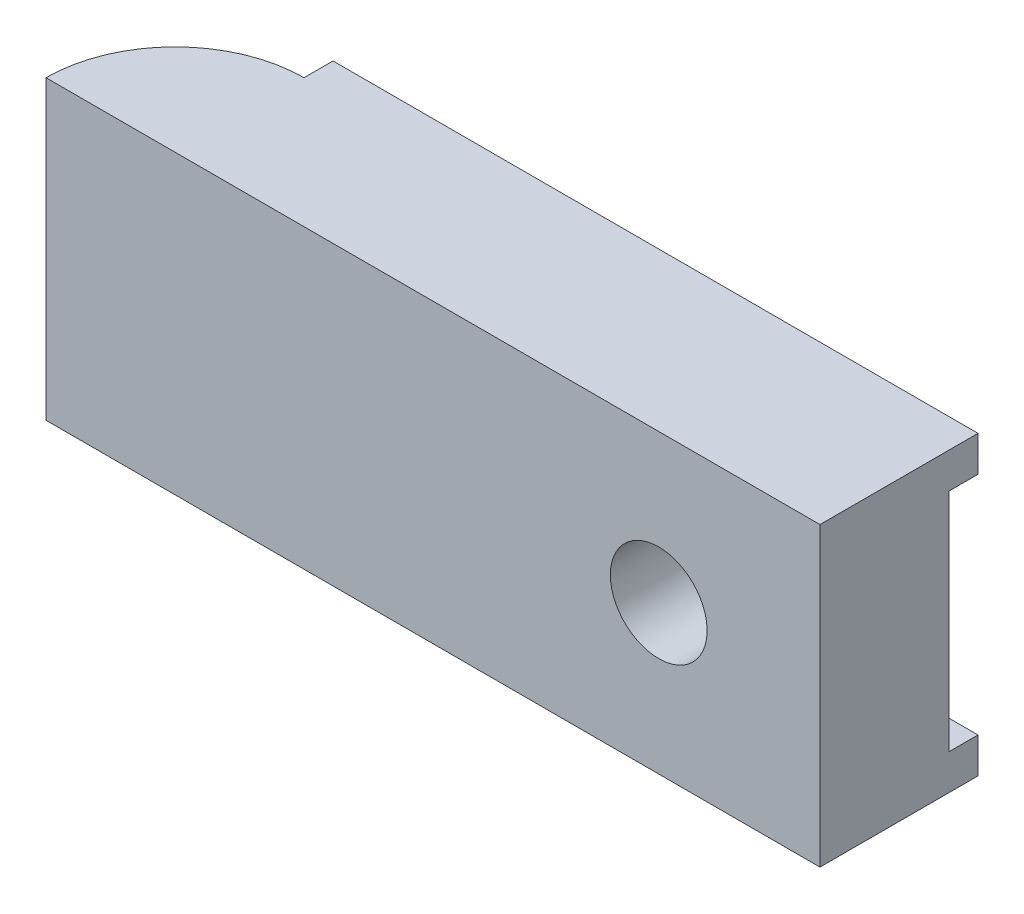
from build123d import *

# Parameters (mm, degrees)
RESSALTO_EXTRUS_O2_DEPTH = 9.2
ESBO_O5_R                = 2.15
CORTE_EXTRUS_O2_DEPTH    = 9.2
CHANFRO2_SIZE            = 0.3
SKETCH1_W                = 12.014068267
SKETCH1_H                = 17.223276929
CUT_EXTRUDE1_DEPTH       = 25
SKETCH3_W                = 4
SKETCH3_H                = 9.2
BOSS_EXTRUDE1_DEPTH      = 5
CUT_EXTRUDE3_DEPTH       = 10
SKETCH5_W                = 42.60578415
SKETCH5_H                = 33.509789151
CUT_EXTRUDE4_DEPTH       = 1.1
SKETCH6_W                = 58.176505701
SKETCH6_H                = 25.888094607
CUT_EXTRUDE5_DEPTH       = 1.1
SKETCH7_W                = 20
SKETCH7_H                = 4.9
BOSS_EXTRUDE2_DEPTH      = 1.1
SKETCH8_W                = 20
SKETCH8_H                = 4.9
BOSS_EXTRUDE3_DEPTH      = 1.1
BOSS_EXTRUDE5_DEPTH      = 9.2


with BuildPart() as part:
    # Esboço4 → Ressalto-extrusão2 (new body)
    with BuildSketch(Plane(origin=(0, 0, 0), x_dir=(1, 0, 0), z_dir=(0, 1, 0))):
        with BuildLine():
            Line((-19.2, 2.35), (-19.2, 1.65))
            ThreePointArc((-19.2, 1.65), (-19.170710678, 1.579289322), (-19.1, 1.55))
            Line((-19.1, 1.55), (-18.1, 1.55))
            ThreePointArc((-18.1, 1.55), (-18.029289322, 1.579289322), (-18, 1.65))
            Line((-18, 1.65), (-18, 2.35))
            ThreePointArc((-18, 2.35), (-17.970710678, 2.420710678), (-17.9, 2.45))
            Line((-17.9, 2.45), (-17.3, 2.45))
            ThreePointArc((-17.3, 2.45), (-17.229289322, 2.420710678), (-17.2, 2.35))
            Line((-17.2, 2.35), (-17.2, 1.65))
            ThreePointArc((-17.2, 1.65), (-17.170710678, 1.579289322), (-17.1, 1.55))
            Line((-17.1, 1.55), (-16.1, 1.55))
            ThreePointArc((-16.1, 1.55), (-16.029289322, 1.579289322), (-16, 1.65))
            Line((-16, 1.65), (-16, 2.35))
            ThreePointArc((-16, 2.35), (-15.970710678, 2.420710678), (-15.9, 2.45))
            Line((-15.9, 2.45), (-15.3, 2.45))
            ThreePointArc((-15.3, 2.45), (-15.229289322, 2.420710678), (-15.2, 2.35))
            Line((-15.2, 2.35), (-15.2, 1.65))
            ThreePointArc((-15.2, 1.65), (-15.170710678, 1.579289322), (-15.1, 1.55))
            Line((-15.1, 1.55), (-14.1, 1.55))
            ThreePointArc((-14.1, 1.55), (-14.029289322, 1.579289322), (-14, 1.65))
            Line((-14, 1.65), (-14, 2.35))
            ThreePointArc((-14, 2.35), (-13.970710678, 2.420710678), (-13.9, 2.45))
            Line((-13.9, 2.45), (-13.3, 2.45))
            ThreePointArc((-13.3, 2.45), (-13.229289322, 2.420710678), (-13.2, 2.35))
            Line((-13.2, 2.35), (-13.2, 1.65))
            ThreePointArc((-13.2, 1.65), (-13.170710678, 1.579289322), (-13.1, 1.55))
            Line((-13.1, 1.55), (-12.1, 1.55))
            ThreePointArc((-12.1, 1.55), (-12.029289322, 1.579289322), (-12, 1.65))
            Line((-12, 1.65), (-12, 2.35))
            ThreePointArc((-12, 2.35), (-11.970710678, 2.420710678), (-11.9, 2.45))
            Line((-11.9, 2.45), (-11.3, 2.45))
            ThreePointArc((-11.3, 2.45), (-11.229289322, 2.420710678), (-11.2, 2.35))
            Line((-11.2, 2.35), (-11.2, 1.65))
            ThreePointArc((-11.2, 1.65), (-11.170710678, 1.579289322), (-11.1, 1.55))
            Line((-11.1, 1.55), (-10.1, 1.55))
            ThreePointArc((-10.1, 1.55), (-10.029289322, 1.579289322), (-10, 1.65))
            Line((-10, 1.65), (-10, 2.35))
            ThreePointArc((-10, 2.35), (-9.970710678, 2.420710678), (-9.9, 2.45))
            Line((-9.9, 2.45), (-9.3, 2.45))
            ThreePointArc((-9.3, 2.45), (-9.229289322, 2.420710678), (-9.2, 2.35))
            Line((-9.2, 2.35), (-9.2, 1.65))
            ThreePointArc((-9.2, 1.65), (-9.170710678, 1.579289322), (-9.1, 1.55))
            Line((-9.1, 1.55), (-8.1, 1.55))
            ThreePointArc((-8.1, 1.55), (-8.029289322, 1.579289322), (-8, 1.65))
            Line((-8, 1.65), (-8, 2.35))
            ThreePointArc((-8, 2.35), (-7.970710678, 2.420710678), (-7.9, 2.45))
            Line((-7.9, 2.45), (-7.3, 2.45))
            ThreePointArc((-7.3, 2.45), (-7.229289322, 2.420710678), (-7.2, 2.35))
            Line((-7.2, 2.35), (-7.2, 1.65))
            ThreePointArc((-7.2, 1.65), (-7.170710678, 1.579289322), (-7.1, 1.55))
            Line((-7.1, 1.55), (7.1, 1.55))
            ThreePointArc((7.1, 1.55), (7.170710678, 1.579289322), (7.2, 1.65))
            Line((7.2, 1.65), (7.2, 2.35))
            ThreePointArc((7.2, 2.35), (7.229289322, 2.420710678), (7.3, 2.45))
            Line((7.3, 2.45), (7.9, 2.45))
            ThreePointArc((7.9, 2.45), (7.970710678, 2.420710678), (8, 2.35))
            Line((8, 2.35), (8, 1.65))
            ThreePointArc((8, 1.65), (8.029289322, 1.579289322), (8.1, 1.55))
            Line((8.1, 1.55), (9.1, 1.55))
            ThreePointArc((9.1, 1.55), (9.170710678, 1.579289322), (9.2, 1.65))
            Line((9.2, 1.65), (9.2, 2.35))
            ThreePointArc((9.2, 2.35), (9.229289322, 2.420710678), (9.3, 2.45))
            Line((9.3, 2.45), (9.9, 2.45))
            ThreePointArc((9.9, 2.45), (9.970710678, 2.420710678), (10, 2.35))
            Line((10, 2.35), (10, 1.65))
            ThreePointArc((10, 1.65), (10.029289322, 1.579289322), (10.1, 1.55))
            Line((10.1, 1.55), (11.1, 1.55))
            ThreePointArc((11.1, 1.55), (11.170710678, 1.579289322), (11.2, 1.65))
            Line((11.2, 1.65), (11.2, 2.35))
            ThreePointArc((11.2, 2.35), (11.229289322, 2.420710678), (11.3, 2.45))
            Line((11.3, 2.45), (11.9, 2.45))
            ThreePointArc((11.9, 2.45), (11.970710678, 2.420710678), (12, 2.35))
            Line((12, 2.35), (12, 1.65))
            ThreePointArc((12, 1.65), (12.029289322, 1.579289322), (12.1, 1.55))
            Line((12.1, 1.55), (13.1, 1.55))
            ThreePointArc((13.1, 1.55), (13.170710678, 1.579289322), (13.2, 1.65))
            Line((13.2, 1.65), (13.2, 2.35))
            ThreePointArc((13.2, 2.35), (13.229289322, 2.420710678), (13.3, 2.45))
            Line((13.3, 2.45), (13.9, 2.45))
            ThreePointArc((13.9, 2.45), (13.970710678, 2.420710678), (14, 2.35))
            Line((14, 2.35), (14, 1.65))
            ThreePointArc((14, 1.65), (14.029289322, 1.579289322), (14.1, 1.55))
            Line((14.1, 1.55), (15.1, 1.55))
            ThreePointArc((15.1, 1.55), (15.170710678, 1.579289322), (15.2, 1.65))
            Line((15.2, 1.65), (15.2, 2.35))
            ThreePointArc((15.2, 2.35), (15.229289322, 2.420710678), (15.3, 2.45))
            Line((15.3, 2.45), (15.9, 2.45))
            ThreePointArc((15.9, 2.45), (15.970710678, 2.420710678), (16, 2.35))
            Line((16, 2.35), (16, 1.65))
            ThreePointArc((16, 1.65), (16.029289322, 1.579289322), (16.1, 1.55))
            Line((16.1, 1.55), (17.1, 1.55))
            ThreePointArc((17.1, 1.55), (17.170710678, 1.579289322), (17.2, 1.65))
            Line((17.2, 1.65), (17.2, 2.35))
            ThreePointArc((17.2, 2.35), (17.229289322, 2.420710678), (17.3, 2.45))
            Line((17.3, 2.45), (17.9, 2.45))
            ThreePointArc((17.9, 2.45), (17.970710678, 2.420710678), (18, 2.35))
            Line((18, 2.35), (18, 1.65))
            ThreePointArc((18, 1.65), (18.029289322, 1.579289322), (18.1, 1.55))
            Line((18.1, 1.55), (19.1, 1.55))
            ThreePointArc((19.1, 1.55), (19.170710678, 1.579289322), (19.2, 1.65))
            Line((19.2, 1.65), (19.2, 2.35))
            ThreePointArc((19.2, 2.35), (19.229289322, 2.420710678), (19.3, 2.45))
            Line((19.3, 2.45), (19.9, 2.45))
            ThreePointArc((19.9, 2.45), (19.970710678, 2.420710678), (20, 2.35))
            Line((20, 2.35), (20, -2.45))
            Line((20, -2.45), (-20, -2.45))
            Line((-20, -2.45), (-20, 2.35))
            ThreePointArc((-20, 2.35), (-19.970710678, 2.420710678), (-19.9, 2.45))
            Line((-19.9, 2.45), (-19.3, 2.45))
            ThreePointArc((-19.3, 2.45), (-19.229289322, 2.420710678), (-19.2, 2.35))
        make_face()
    extrude(amount=RESSALTO_EXTRUS_O2_DEPTH)

    # Esboço5 → Corte-extrusão2 (cut)
    with BuildSketch(Plane(origin=(0, 0, -1.55), x_dir=(-1, 0, 0), z_dir=(0, 0, -1))):
        with Locations((0, 4.6)):
            Circle(ESBO_O5_R)
    extrude(amount=-CORTE_EXTRUS_O2_DEPTH, mode=Mode.SUBTRACT)

    # Chanfro2
    chanfro2_edges = [part.edges().sort_by_distance(p)[0] for p in [
        (2.15, 4.6, -1.55),
    ]]
    chamfer(chanfro2_edges, length=CHANFRO2_SIZE)

    # Sketch1 → Cut-Extrude1 (cut)
    with BuildSketch(Plane(origin=(20, 0, 0), x_dir=(0, 0, -1), z_dir=(1, 0, 0))):
        with Locations((-0.254525551, 3.53223116)):
            Rectangle(SKETCH1_W, SKETCH1_H)
    extrude(amount=-CUT_EXTRUDE1_DEPTH, mode=Mode.SUBTRACT)

    # Sketch3 → Boss-Extrude1 (add)
    with BuildSketch(Plane(origin=(-5, 0, 0), x_dir=(0, 0, -1), z_dir=(1, 0, 0))):
        with Locations((-0.45, 4.6)):
            Rectangle(SKETCH3_W, SKETCH3_H)
    extrude(amount=BOSS_EXTRUDE1_DEPTH)

    # Sketch4 → Cut-Extrude3 (cut)
    with BuildSketch(Plane(origin=(0, 0, -1.55), x_dir=(-1, 0, 0), z_dir=(0, 0, -1))):
        with BuildLine():
            ThreePointArc((3.5, 4.6), (5, 3.1), (6.5, 4.6))
            ThreePointArc((6.5, 4.6), (5, 6.1), (3.5, 4.6))
        make_face()
    extrude(amount=-CUT_EXTRUDE3_DEPTH, mode=Mode.SUBTRACT)

    # Sketch5 → Cut-Extrude4 (cut)
    with BuildSketch(Plane.XZ):
        with Locations((-12.27909741, -6.492410197)):
            Rectangle(SKETCH5_W, SKETCH5_H)
    extrude(amount=-CUT_EXTRUDE4_DEPTH, mode=Mode.SUBTRACT)

    # Sketch6 → Cut-Extrude5 (cut)
    with BuildSketch(Plane(origin=(0, 9.2, 0), x_dir=(1, 0, 0), z_dir=(0, 1, 0))):
        with Locations((-5.279993837, 3.701095613)):
            Rectangle(SKETCH6_W, SKETCH6_H)
    extrude(amount=-CUT_EXTRUDE5_DEPTH, mode=Mode.SUBTRACT)

    # Sketch7 → Boss-Extrude2 (add)
    with BuildSketch(Plane(origin=(0, 8.1, 0), x_dir=(1, 0, 0), z_dir=(0, 1, 0))):
        with Locations((-10, 0)):
            Rectangle(SKETCH7_W, SKETCH7_H)
    extrude(amount=BOSS_EXTRUDE2_DEPTH)

    # Sketch8 → Boss-Extrude3 (add)
    with BuildSketch(Plane.XZ.offset(-1.1)):
        with Locations((-10, 0)):
            Rectangle(SKETCH8_W, SKETCH8_H)
    extrude(amount=BOSS_EXTRUDE3_DEPTH)

    # Sketch12 → Boss-Extrude5 (add)
    with BuildSketch(Plane.XZ):
        with BuildLine():
            Line((-20, 2.45), (-24, 2.45))
            ThreePointArc((-24, 2.45), (-22.828427125, -0.378427125), (-20, -1.55))
            Line((-20, -1.55), (-20, 2.45))
        make_face()
    extrude(amount=-BOSS_EXTRUDE5_DEPTH)


solid = part.part
